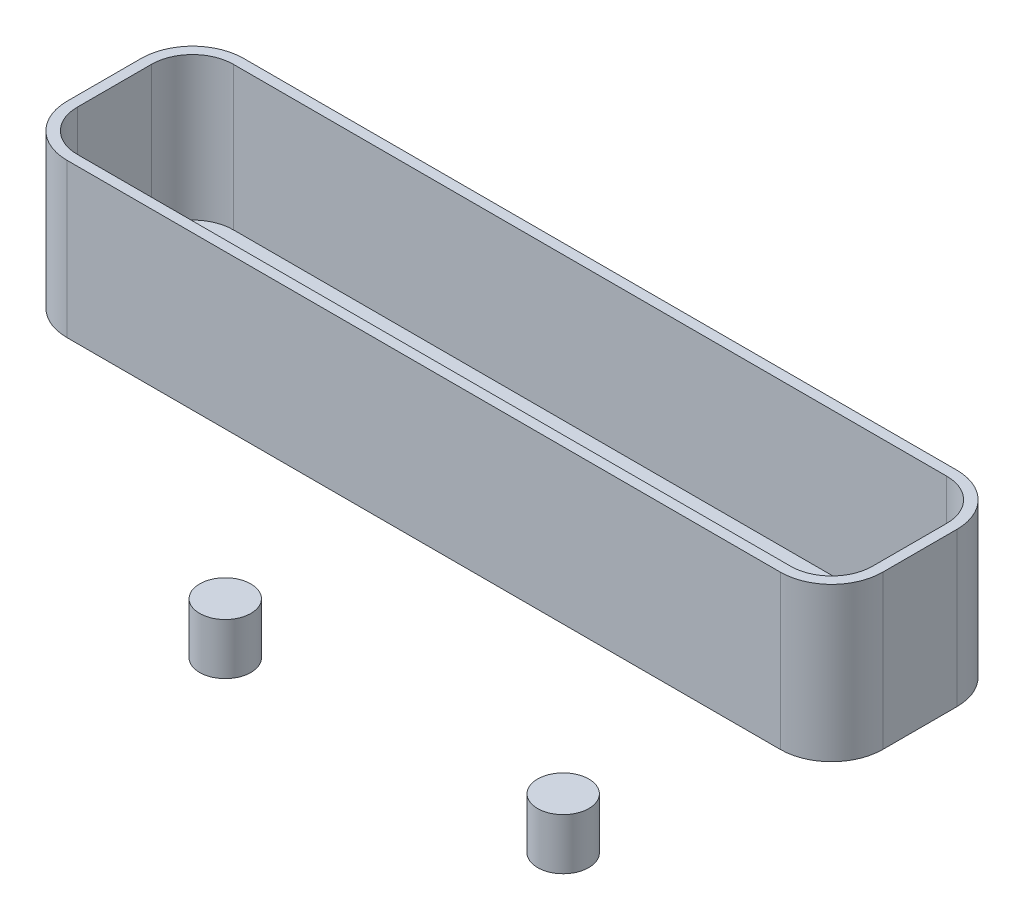
from build123d import *

# Parameters (mm, degrees)
SKETCH1_R             = 5
BOSS_EXTRUDE1_DEPTH   = 10
BOSS_EXTRUDE1_2_DEPTH = 10
BOSS_EXTRUDE1_3_DEPTH = 10
BOSS_EXTRUDE1_4_DEPTH = 10
SKETCH3_W             = 159.302332208
SKETCH3_H             = 34.481731404
BOSS_EXTRUDE3_DEPTH   = 30
FILLET1_R             = 10
SHELL1_T              = -2


with BuildPart() as part:
    # Sketch1 → Boss-Extrude1 (new body)
    with BuildSketch(Plane.XZ):
        with Locations((-33, 23)):
            Circle(SKETCH1_R)
    extrude(amount=BOSS_EXTRUDE1_DEPTH)


with BuildPart() as body_2:
    # Sketch1 → Boss-Extrude1 2 (new body)
    with BuildSketch(Plane.XZ):
        with Locations((33, 23)):
            Circle(SKETCH1_R)
    extrude(amount=BOSS_EXTRUDE1_2_DEPTH)


with BuildPart() as body_3:
    # Sketch1 → Boss-Extrude1 3 (new body)
    with BuildSketch(Plane.XZ):
        with Locations((-33, -23)):
            Circle(SKETCH1_R)
    extrude(amount=BOSS_EXTRUDE1_3_DEPTH)


with BuildPart() as body_4:
    # Sketch1 → Boss-Extrude1 4 (new body)
    with BuildSketch(Plane.XZ):
        with Locations((33, -23.22671073)):
            Circle(SKETCH1_R)
    extrude(amount=BOSS_EXTRUDE1_4_DEPTH)


with BuildPart() as body_5:
    # Sketch3 → Boss-Extrude3 (new body)
    with BuildSketch(Plane(origin=(0, 22.929130899, 0), x_dir=(1, 0, 0), z_dir=(0, 1, 0))):
        Rectangle(SKETCH3_W, SKETCH3_H)
    extrude(amount=BOSS_EXTRUDE3_DEPTH)

    # Fillet1
    fillet1_edges = [body_5.edges().sort_by_distance(p)[0] for p in [
        (-79.651166104, 37.929130899, 17.240865702),
        (-79.651166104, 37.929130899, -17.240865702),
        (79.651166104, 37.929130899, 17.240865702),
        (79.651166104, 37.929130899, -17.240865702),
    ]]
    fillet(fillet1_edges, radius=FILLET1_R)

    # Shell1
    shell1_openings = [body_5.faces().sort_by_distance(p)[0] for p in [
        (0, 52.929130899, 0),
    ]]
    offset(amount=SHELL1_T, openings=shell1_openings, kind=Kind.INTERSECTION)


solid = Compound([part.part, body_2.part, body_3.part, body_4.part, body_5.part])
